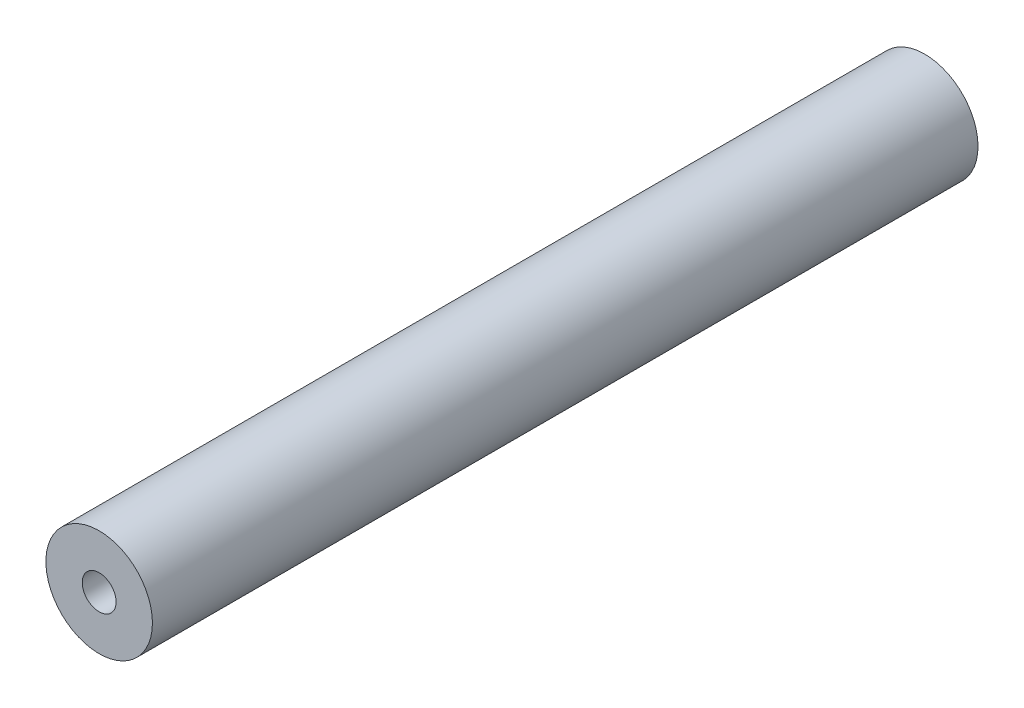
from build123d import *

# Parameters (mm, degrees)
SKETCH1_R                            = 6.35
BOSS_EXTRUDE1_DEPTH                  = 49.2125
F_10_32_TAPPED_HOLE1_D               = 4.0386
F_10_32_TAPPED_HOLE1_DEPTH           = 12.02944
F_10_32_TAPPED_HOLE1_TIP             = 1.213317848
F_10_32_TAPPED_HOLE1_ON_FACE_2_D     = 4.0386
F_10_32_TAPPED_HOLE1_ON_FACE_2_DEPTH = 12.02944
F_10_32_TAPPED_HOLE1_ON_FACE_2_TIP   = 1.213317848


with BuildPart() as part:
    # Sketch1 → Boss-Extrude1 (new, symmetric)
    with BuildSketch(Plane.XY):
        Circle(SKETCH1_R)
    extrude(amount=BOSS_EXTRUDE1_DEPTH, both=True)

    # #10-32 Tapped Hole1
    with Locations(Plane(origin=(0, 0, -49.2125), x_dir=(-1, 0, 0), z_dir=(0, 0, -1))):
        with Locations((0, 0)):
            Hole(F_10_32_TAPPED_HOLE1_D / 2, depth=F_10_32_TAPPED_HOLE1_DEPTH)
            with Locations((0, 0, -(F_10_32_TAPPED_HOLE1_DEPTH + F_10_32_TAPPED_HOLE1_TIP / 2))):  # 118° drill point
                Cone(0, F_10_32_TAPPED_HOLE1_D / 2, F_10_32_TAPPED_HOLE1_TIP, mode=Mode.SUBTRACT)

    # #10-32 Tapped Hole1 on face 2
    with Locations(Plane.XY.offset(49.2125)):
        with Locations((0, 0)):
            Hole(F_10_32_TAPPED_HOLE1_ON_FACE_2_D / 2, depth=F_10_32_TAPPED_HOLE1_ON_FACE_2_DEPTH)
            with Locations((0, 0, -(F_10_32_TAPPED_HOLE1_ON_FACE_2_DEPTH + F_10_32_TAPPED_HOLE1_ON_FACE_2_TIP / 2))):  # 118° drill point
                Cone(0, F_10_32_TAPPED_HOLE1_ON_FACE_2_D / 2, F_10_32_TAPPED_HOLE1_ON_FACE_2_TIP, mode=Mode.SUBTRACT)


solid = part.part
